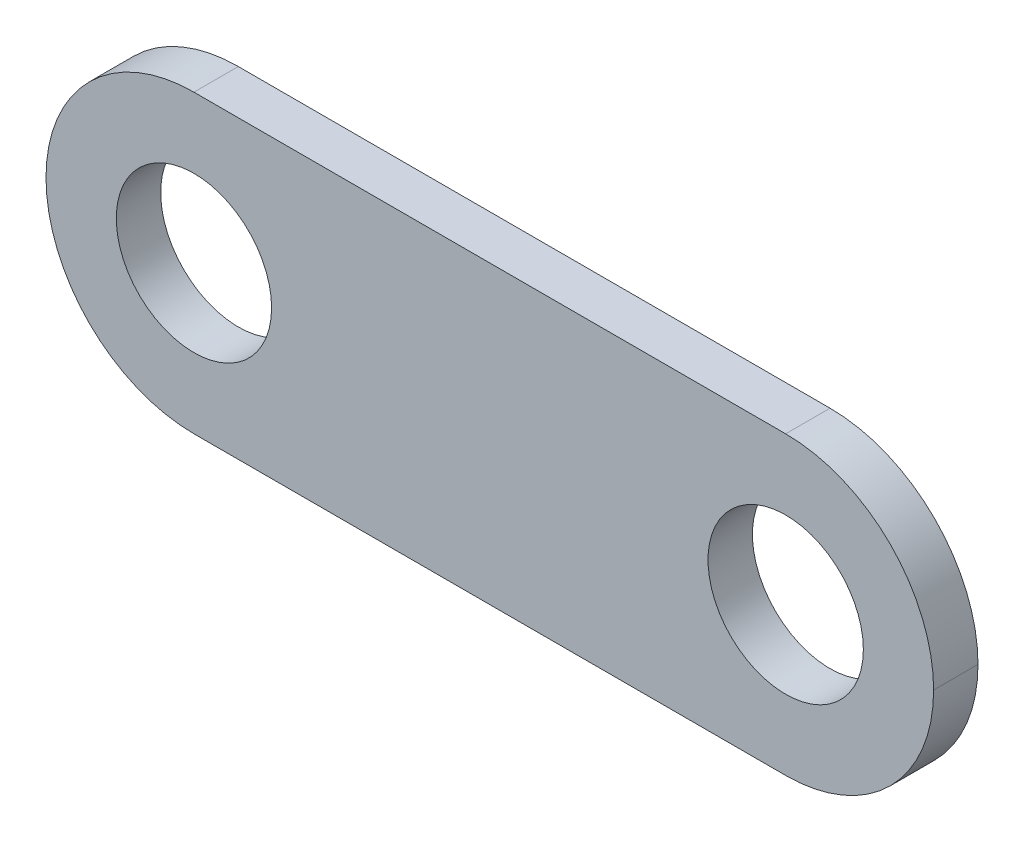
from build123d import *

# Parameters (mm, degrees)
SKETCH_1_W          = 60
SKETCH_1_H          = 20
EXTRUDE_1_DEPTH     = 3
FILLET_1_R          = 10
HOLE_WIZARD_M10_1_D = 10.5


with BuildPart() as part:
    # ｽｹｯﾁ1 → ﾎﾞｽ - 押し出し1 (new body)
    with BuildSketch(Plane.XY):
        with Locations((30, 10)):
            Rectangle(SKETCH_1_W, SKETCH_1_H)
    extrude(amount=EXTRUDE_1_DEPTH)

    # ﾌｨﾚｯﾄ1
    fillet_1_edges = [part.edges().sort_by_distance(p)[0] for p in [
        (60, 0, 1.5),
        (60, 20, 1.5),
        (0, 0, 1.5),
        (0, 20, 1.5),
    ]]
    fillet(fillet_1_edges, radius=FILLET_1_R - 0.0001)  # a hair under: the kernel refuses the full size

    # M10 すきま穴1 (through all)
    with Locations(Plane.XY.offset(3)):
        with Locations((10, 10), (50, 10)):
            Hole(HOLE_WIZARD_M10_1_D / 2)


solid = part.part
